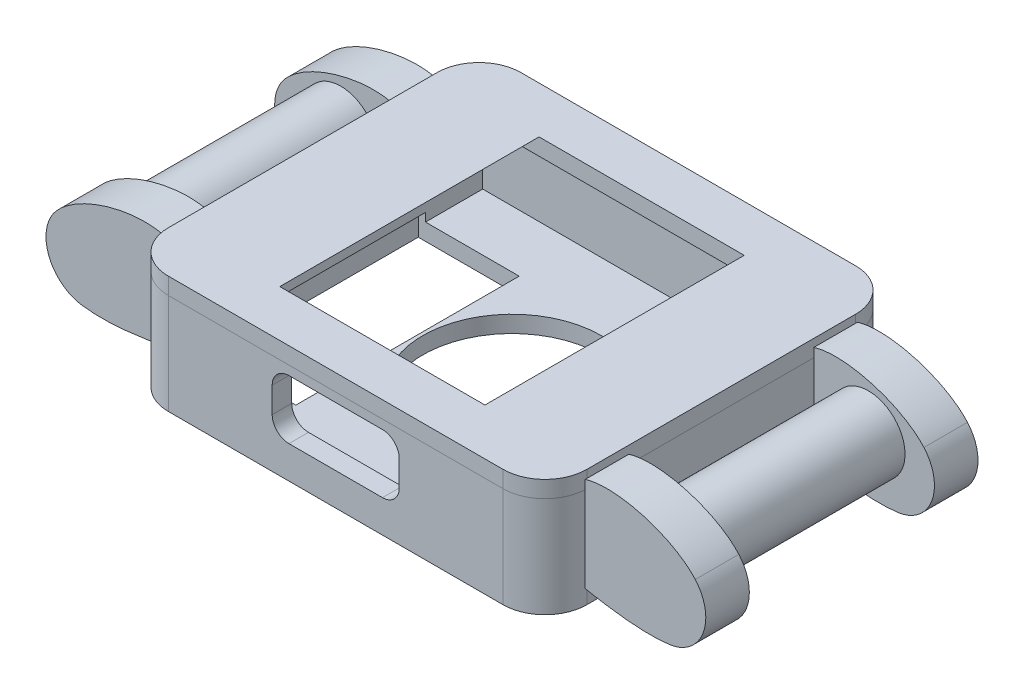
from build123d import *

# Parameters (mm, degrees)
SKETCH1_W                = 49.976384144
SKETCH1_H                = 42.104287242
SKETCH1_R                = 10.647598488
BOSS_EXTRUDE2_DEPTH      = 2
SKETCH2_W                = 49.976384144
SKETCH2_H                = 42.104287242
SKETCH2_W_2              = 44.439076198
SKETCH2_H_2              = 37.439195754
BOSS_EXTRUDE3_DEPTH      = 10
CUT_EXTRUDE1_DEPTH       = 10
SKETCH4_W                = 49.976384144
SKETCH4_H                = 42.104287242
BOSS_EXTRUDE4_DEPTH      = 2
SKETCH5_W                = 22.497186092
SKETCH5_H                = 30.96041324
CUT_EXTRUDE2_DEPTH       = 3
SKETCH6_W                = 12.052063978
SKETCH6_H                = 26.675234937
CUT_EXTRUDE3_DEPTH       = 3
FILLET3_R                = 5
FILLET4_R                = 5
FILLET5_R                = 5
FILLET6_R                = 5
CHAMFER1_SIZE            = 3
BOSS_EXTRUDE5_DEPTH      = 16.052144
BOSS_EXTRUDE5_DEPTH_BACK = 16.052144
SKETCH7_R                = 4.376614107
BOSS_EXTRUDE7_DEPTH      = 0.2
BOSS_EXTRUDE7_DEPTH_BACK = 5


with BuildPart() as part:
    # Sketch1 → Boss-Extrude2 (new body)
    with BuildSketch(Plane(origin=(0, 0, 0), x_dir=(1, 0, 0), z_dir=(0, 1, 0))):
        Rectangle(SKETCH1_W, SKETCH1_H)
        with Locations(Location((0, 0, 0), (0, 0, 270))):
            Circle(SKETCH1_R, mode=Mode.SUBTRACT)
    extrude(amount=BOSS_EXTRUDE2_DEPTH)

    # Sketch2 → Boss-Extrude3 (add)
    with BuildSketch(Plane(origin=(0, 2, 0), x_dir=(1, 0, 0), z_dir=(0, 1, 0))):
        Rectangle(SKETCH2_W, SKETCH2_H)
        Rectangle(SKETCH2_W_2, SKETCH2_H_2, mode=Mode.SUBTRACT)
    extrude(amount=BOSS_EXTRUDE3_DEPTH)

    # Sketch3 → Cut-Extrude1 (cut)
    with BuildSketch(Plane.XY.offset(21.052143621)):
        with BuildLine():
            Line((-7.585558373, 5.87765836), (-7.585558373, 8.917504734))
            ThreePointArc((-7.585558373, 8.917504734), (-6.999771935, 10.331718297), (-5.585558373, 10.917504734))
            Line((-5.585558373, 10.917504734), (5.585558373, 10.917504734))
            ThreePointArc((5.585558373, 10.917504734), (6.999771935, 10.331718297), (7.585558373, 8.917504734))
            Line((7.585558373, 8.917504734), (7.585558373, 5.87765836))
            ThreePointArc((7.585558373, 5.87765836), (6.999771935, 4.463444798), (5.585558373, 3.87765836))
            Line((5.585558373, 3.87765836), (-5.585558373, 3.87765836))
            ThreePointArc((-5.585558373, 3.87765836), (-6.999771935, 4.463444798), (-7.585558373, 5.87765836))
        make_face()
    extrude(amount=-CUT_EXTRUDE1_DEPTH, mode=Mode.SUBTRACT)

    # Sketch6 → Cut-Extrude3 (cut)
    with BuildSketch(Plane.XZ):
        with Locations((-17.06036612, 1.446247677)):
            Rectangle(SKETCH6_W, SKETCH6_H)
    extrude(amount=-CUT_EXTRUDE3_DEPTH, mode=Mode.SUBTRACT)

    # Fillet3
    fillet3_edges = [part.edges().sort_by_distance(p)[0] for p in [
        (-24.988192072, 6, 21.052143621),
    ]]
    fillet(fillet3_edges, radius=FILLET3_R)

    # Fillet5
    fillet5_edges = [part.edges().sort_by_distance(p)[0] for p in [
        (-24.988192072, 6, -21.052143621),
        (24.988192072, 6, 21.052143621),
        (24.988192072, 6, -21.052143621),
    ]]
    fillet(fillet5_edges, radius=FILLET5_R)


with BuildPart() as body_2:
    # Sketch4 → Boss-Extrude4 (new body)
    with BuildSketch(Plane(origin=(0, 12, 0), x_dir=(1, 0, 0), z_dir=(0, 1, 0))):
        Rectangle(SKETCH4_W, SKETCH4_H)
    extrude(amount=BOSS_EXTRUDE4_DEPTH)

    # Sketch5 → Cut-Extrude2 (cut)
    with BuildSketch(Plane(origin=(0, 14, 0), x_dir=(1, 0, 0), z_dir=(0, 1, 0))):
        Rectangle(SKETCH5_W, SKETCH5_H)
    extrude(amount=-CUT_EXTRUDE2_DEPTH, mode=Mode.SUBTRACT)

    # Fillet4
    fillet4_edges = [body_2.edges().sort_by_distance(p)[0] for p in [
        (-24.988192072, 13, 21.052143621),
        (-24.988192072, 13, -21.052143621),
    ]]
    fillet(fillet4_edges, radius=FILLET4_R)

    # Fillet6
    fillet6_edges = [body_2.edges().sort_by_distance(p)[0] for p in [
        (24.988192072, 13, 21.052143621),
        (24.988192072, 13, -21.052143621),
    ]]
    fillet(fillet6_edges, radius=FILLET6_R)

    # Chamfer1
    # the kernel refuses this chamfer: 3 mm, written as the material it takes off along each edge
    with BuildSketch(Plane(origin=(-11.248593046, 12, -15.48020662), x_dir=(-0.9996219169112969, -0.02749587661058621, 0), z_dir=(0, 0, 1)), Plane(origin=(11.248593046, 12, 15.48020662), x_dir=(0.9996219169112969, -0.02749587661058621, 0), z_dir=(0, 0, -1))) as chamfer1_piece_1:
        Polygon((CHAMFER1_SIZE * 0.999621916911, -CHAMFER1_SIZE * 0.0274958766106), (-CHAMFER1_SIZE * 0.0274958766106, -CHAMFER1_SIZE * 0.999621916911), (0, 0), align=None)
    extrude(amount=30.960413241, mode=Mode.SUBTRACT)


with BuildPart() as body_3:
    # Sketch7 → Boss-Extrude5 (new, two sides: drawn at the far end of the back side and taken through both)
    with BuildSketch(Plane(origin=(0, 0, 0), x_dir=(-1, 0, 0), z_dir=(0, 0, -1)).offset(-BOSS_EXTRUDE5_DEPTH_BACK)):
        with Locations((-31.505407588, 7.46002795)):
            Circle(SKETCH7_R)
    extrude(amount=BOSS_EXTRUDE5_DEPTH + BOSS_EXTRUDE5_DEPTH_BACK)


with BuildPart() as body_4:
    # Mirror1: mirrored copy
    add(body_3.part.mirror(Plane(origin=(0, 0, 0), x_dir=(0, 0, 1), z_dir=(1, 0, 0))))


with BuildPart() as body_5:
    # Sketch8 → Boss-Extrude7 (new, two sides: drawn at the far end of the back side and taken through both)
    with BuildSketch(Plane(origin=(0, 0, -16.052143621), x_dir=(-1, 0, 0), z_dir=(0, 0, -1)).offset(-BOSS_EXTRUDE7_DEPTH_BACK)):
        with BuildLine():
            Line((-24.632270624, 12.951501751), (-24.073830772, 1.958385001))
            add(Edge.make_bspline(
                [(-24.073830772, 1.958385001), (-28.757214086, 0.978704203), (-32.41859253, 0.665498797), (-35.057966104, 1.018768784)],
                knots=[0, 0, 0, 0, 0.375825094, 0.375825094, 0.375825094, 0.375825094], degree=3))
            ThreePointArc((-35.057966104, 1.018768784), (-39.080137155, 4.229233655), (-38.138514088, 9.288708989))
            add(Edge.make_bspline(
                [(-24.632270624, 12.951501751), (-28.43707339, 14.362948841), (-35.384738996, 12.399554019), (-38.138514088, 9.288708989)],
                knots=[0, 0, 0, 0, 0.766664449, 0.766664449, 0.766664449, 0.766664449], degree=3))
        make_face()
    extrude(amount=BOSS_EXTRUDE7_DEPTH + BOSS_EXTRUDE7_DEPTH_BACK)


with BuildPart() as body_6:
    # Mirror3: mirrored copy
    add(body_5.part.mirror(Plane(origin=(0, 0, 0), x_dir=(1, 0, 0), z_dir=(0, 0, -1))))


with BuildPart() as body_7:
    # Mirror4: mirrored copy
    add(body_5.part.mirror(Plane(origin=(0, 0, 0), x_dir=(0, 0, 1), z_dir=(1, 0, 0))))


with BuildPart() as body_8:
    # Mirror4 2: mirrored copy
    add(body_6.part.mirror(Plane(origin=(0, 0, 0), x_dir=(0, 0, 1), z_dir=(1, 0, 0))))


solid = Compound([part.part, body_2.part, body_3.part, body_4.part, body_5.part, body_6.part, body_7.part, body_8.part])
